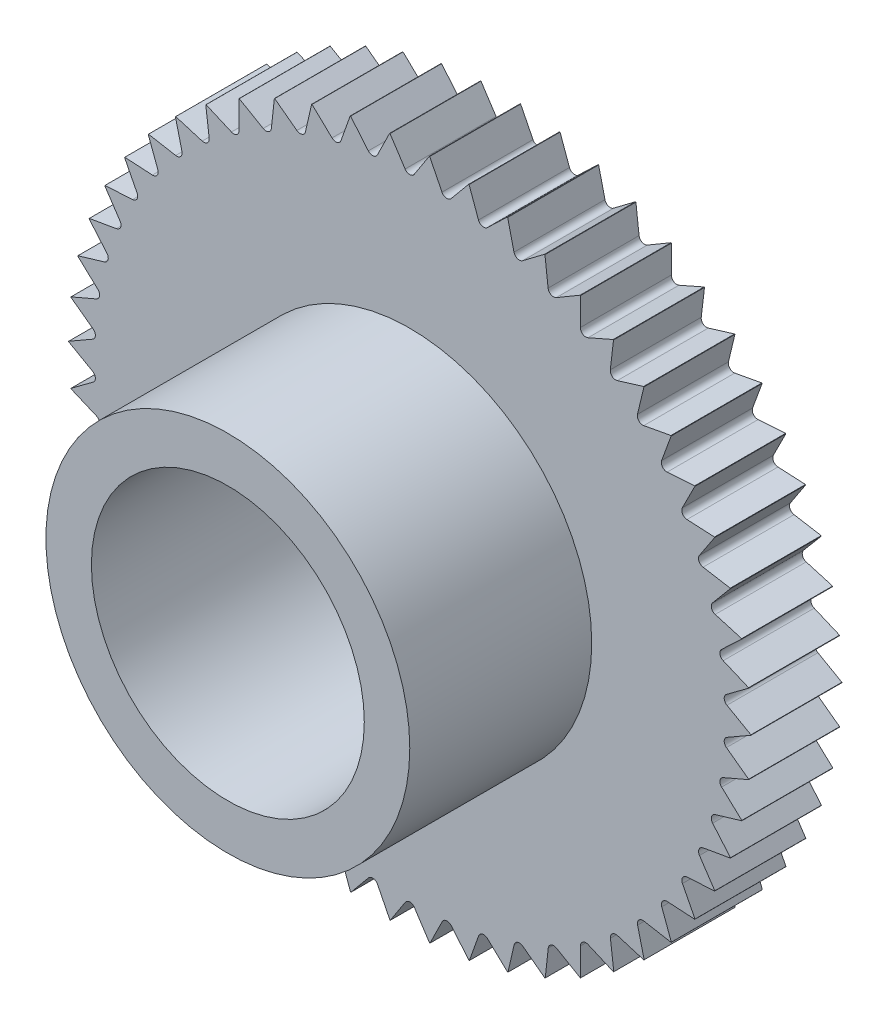
from build123d import *

# Parameters (mm, degrees)
SKETCH1_R           = 7.5
SKETCH1_R_2         = 3
BOSS_EXTRUDE1_DEPTH = 2
SKETCH2_R           = 4
SKETCH2_R_2         = 3
BOSS_EXTRUDE2_DEPTH = 4
CUT_EXTRUDE1_DEPTH  = 4
CIRPATTERN2_DEPTH   = 2


# Read off the part's stored shape, not the designer's step: CirPattern2
with BuildPart() as part:
    # Sketch1 → Boss-Extrude1 (new body)
    with BuildSketch(Plane.XY):
        Circle(SKETCH1_R)
        Circle(SKETCH1_R_2, mode=Mode.SUBTRACT)
    extrude(amount=BOSS_EXTRUDE1_DEPTH)

    # Sketch2 → Boss-Extrude2 (add)
    with BuildSketch(Plane.XY.offset(2)):
        Circle(SKETCH2_R)
        Circle(SKETCH2_R_2, mode=Mode.SUBTRACT)
    extrude(amount=BOSS_EXTRUDE2_DEPTH)

    # Sketch3 → Cut-Extrude1 (cut)
    with BuildSketch(Plane.XY.offset(2)):
        with BuildLine():
            Line((-0.102196566, 6.979193161), (-0.456130011, 7.519067318))
            ThreePointArc((-0.456130011, 7.519067318), (-0.003192278, 7.59724989), (0.450180792, 7.521632669))
            Line((0.450180792, 7.521632669), (0.098937855, 6.97918994))
            ThreePointArc((0.098937855, 6.97918994), (-0.001630231, 6.924500456), (-0.102196566, 6.979193161))
        make_face()
    extrude(amount=-CUT_EXTRUDE1_DEPTH, mode=Mode.SUBTRACT)

    # CirPattern2 outline → CirPattern2 (cut)
    with BuildSketch(Plane.XY):
        with BuildLine():
            ThreePointArc((0.708729323, 6.943866651), (0.802266229, 6.877868719), (0.908503371, 6.920513171))
            Line((0.908503371, 6.920513171), (1.294630408, 7.387417148))
            ThreePointArc((1.294630408, 7.387417148), (0.867169952, 7.449699073), (0.436832782, 7.487267667))
            Line((0.436832782, 7.487267667), (0.708729323, 6.943866651))
        make_face()
        with BuildLine():
            ThreePointArc((-0.44392216, 7.48685068), (-0.874223564, 7.448874623), (-1.301624855, 7.38618797))
            Line((-1.301624855, 7.38618797), (-0.911740421, 6.920138056))
            ThreePointArc((-0.911740421, 6.920138056), (-0.805504645, 6.877490203), (-0.711965626, 6.943485138))
            Line((-0.711965626, 6.943485138), (-0.44392216, 7.48685068))
        make_face()
        with BuildLine():
            ThreePointArc((-1.31009083, 7.384691057), (-1.733073939, 7.297016836), (-2.150307819, 7.185135786))
            Line((-2.150307819, 7.185135786), (-1.708954552, 6.767499956))
            ThreePointArc((-1.708954552, 6.767499956), (-1.598485991, 6.737473693), (-1.513240993, 6.813881611))
            Line((-1.513240993, 6.813881611), (-1.31009083, 7.384691057))
        make_face()
        with BuildLine():
            ThreePointArc((-2.158542769, 7.182666155), (-2.568487462, 7.046479414), (-2.969911558, 6.886916967))
            Line((-2.969911558, 6.886916967), (-2.483058004, 6.523343028))
            ThreePointArc((-2.483058004, 6.523343028), (-2.369850555, 6.506344409), (-2.294052372, 6.592132025))
            Line((-2.294052372, 6.592132025), (-2.158542769, 7.182666155))
        make_face()
        with BuildLine():
            ThreePointArc((-2.97780412, 6.883508015), (-3.369166598, 6.700650447), (-3.749352338, 6.495564411))
            Line((-3.749352338, 6.495564411), (-3.223582356, 6.190969077))
            ThreePointArc((-3.223582356, 6.190969077), (-3.109166956, 6.187227979), (-3.043840627, 6.281235161))
            Line((-3.043840627, 6.281235161), (-2.97780412, 6.883508015))
        make_face()
        with BuildLine():
            ThreePointArc((-3.756795779, 6.491262238), (-4.124283536, 6.264206676), (-4.478089561, 6.016370488))
            Line((-4.478089561, 6.016370488), (-3.920513287, 5.774872889))
            ThreePointArc((-3.920513287, 5.774872889), (-3.806437208, 5.784439904), (-3.75246616, 5.885395368))
            Line((-3.75246616, 5.885395368), (-3.756795779, 6.491262238))
        make_face()
        with BuildLine():
            ThreePointArc((-4.484983219, 6.011233275), (-4.823626613, 5.743050258), (-5.146268303, 5.455815477))
            Line((-5.146268303, 5.455815477), (-4.564426001, 5.280681452))
            ThreePointArc((-4.564426001, 5.280681452), (-4.452231926, 5.303427203), (-4.410346025, 5.409965698))
            Line((-4.410346025, 5.409965698), (-4.484983219, 6.011233275))
        make_face()
        with BuildLine():
            ThreePointArc((-5.152518955, 5.449912694), (-5.457738416, 5.144228936), (-5.744852595, 4.82147992))
            Line((-5.744852595, 4.82147992), (-5.146612683, 4.715077858))
            ThreePointArc((-5.146612683, 4.715077858), (-5.037817845, 4.750694747), (-5.008583527, 4.861375523))
            Line((-5.008583527, 4.861375523), (-5.152518955, 5.449912694))
        make_face()
        with BuildLine():
            ThreePointArc((-5.750375711, 4.814891394), (-6.018043669, 4.475840743), (-6.265747611, 4.121942118))
            Line((-6.265747611, 4.121942118), (-5.659200258, 4.085710924))
            ThreePointArc((-5.659200258, 4.085710924), (-5.555275921, 4.133717295), (-5.539088528, 4.247043584))
            Line((-5.539088528, 4.247043584), (-5.750375711, 4.814891394))
        make_face()
        with BuildLine():
            ThreePointArc((-6.270468501, 4.114756947), (-6.496965205, 3.746924482), (-6.701909139, 3.366662121))
            Line((-6.701909139, 3.366662121), (-6.095256858, 3.401091758))
            ThreePointArc((-6.095256858, 3.401091758), (-5.997608419, 3.460838406), (-5.994686859, 3.575277665))
            Line((-5.994686859, 3.575277665), (-6.270468501, 4.114756947))
        make_face()
        with BuildLine():
            ThreePointArc((-6.705763961, 3.358977471), (-6.888026432, 2.967337495), (-7.047438844, 2.565853794))
            Line((-7.047438844, 2.565853794), (-6.448885565, 2.670478662))
            ThreePointArc((-6.448885565, 2.670478662), (-6.358833552, 2.741157616), (-6.369217334, 2.85516225))
            Line((-6.369217334, 2.85516225), (-6.705763961, 3.358977471))
        make_face()
        with BuildLine():
            ThreePointArc((-7.050375466, 2.557773588), (-7.185938919, 2.14762236), (-7.297664027, 1.730346696))
            Line((-7.297664027, 1.730346696), (-6.715304158, 1.903751922))
            ThreePointArc((-6.715304158, 1.903751922), (-6.63406637, 1.984407371), (-6.65761507, 2.096435664))
            Line((-6.65761507, 2.096435664), (-7.050375466, 2.557773588))
        make_face()
        with BuildLine():
            ThreePointArc((-7.299642739, 1.721980204), (-7.386673908, 1.298864316), (-7.449200824, 0.871439628))
            Line((-7.449200824, 0.871439628), (-6.890909782, 1.111280204))
            ThreePointArc((-6.890909782, 1.111280204), (-6.819584821, 1.200821421), (-6.855979985, 1.309358381))
            Line((-6.855979985, 1.309358381), (-7.299642739, 1.721980204))
        make_face()
        with BuildLine():
            ThreePointArc((-7.450194866, 0.862899992), (-7.487516805, 0.43254136), (-7.499999959, 0.000747833))
            Line((-7.499999959, 0.000747833), (-6.973327673, 0.303780327))
            ThreePointArc((-6.973327673, 0.303780327), (-6.912880087, 0.400996421), (-6.961629531, 0.504574272))
            Line((-6.961629531, 0.504574272), (-7.450194866, 0.862899992))
        make_face()
        with BuildLine():
            ThreePointArc((-7.499995888, -0.007849462), (-7.487103882, -0.439630976), (-7.44937446, -0.869954076))
            Line((-7.44937446, -0.869954076), (-6.961443269, -0.507827658))
            ThreePointArc((-6.961443269, -0.507827658), (-6.912690508, -0.404251368), (-6.97313498, -0.307033338))
            Line((-6.97313498, -0.307033338), (-7.499995888, -0.007849462))
        make_face()
        with BuildLine():
            ThreePointArc((-7.448372332, -0.878492766), (-7.385440723, -1.305858056), (-7.298008951, -1.728891346))
            Line((-7.298008951, -1.728891346), (-6.855417287, -1.312568144))
            ThreePointArc((-6.855417287, -1.312568144), (-6.819018648, -1.20403235), (-6.890340741, -1.114488848))
            Line((-6.890340741, -1.114488848), (-7.448372332, -0.878492766))
        make_face()
        with BuildLine():
            ThreePointArc((-7.296022318, -1.737255961), (-7.183902148, -2.154425647), (-7.047950391, -2.564448328))
            Line((-7.047950391, -2.564448328), (-6.656683547, -2.099558398))
            ThreePointArc((-6.656683547, -2.099558398), (-6.633131259, -1.98753086), (-6.714366464, -1.906872809))
            Line((-6.714366464, -1.906872809), (-7.296022318, -1.737255961))
        make_face()
        with BuildLine():
            ThreePointArc((-7.045006118, -2.572525751), (-6.88521362, -2.973858327), (-6.702580393, -3.365325545))
            Line((-6.702580393, -3.365325545), (-6.367929582, -2.858155727))
            ThreePointArc((-6.367929582, -2.858155727), (-6.357542149, -2.744151425), (-6.447591898, -2.673469587))
            Line((-6.447591898, -2.673469587), (-7.045006118, -2.572525751))
        make_face()
        with BuildLine():
            ThreePointArc((-6.698718297, -3.373006541), (-6.49341439, -3.753074674), (-6.266569492, -4.120692508))
            Line((-6.266569492, -4.120692508), (-5.993060292, -3.578101403))
            ThreePointArc((-5.993060292, -3.578101403), (-5.995978188, -3.46366205), (-6.093624713, -3.403912275))
            Line((-6.093624713, -3.403912275), (-6.698718297, -3.373006541))
        make_face()
        with BuildLine():
            ThreePointArc((-6.261841801, -4.127873206), (-6.013802869, -4.481537125), (-5.74581399, -4.820334174))
            Line((-5.74581399, -4.820334174), (-5.537145144, -4.249659395))
            ThreePointArc((-5.537145144, -4.249659395), (-5.553328907, -4.136332587), (-5.657251707, -4.088322888))
            Line((-5.657251707, -4.088322888), (-6.261841801, -4.127873206))
        make_face()
        with BuildLine():
            ThreePointArc((-5.740284638, -4.826917467), (-5.452864981, -5.149394475), (-5.14735621, -5.454789089))
            Line((-5.14735621, -5.454789089), (-5.006349606, -4.863748034))
            ThreePointArc((-5.006349606, -4.863748034), (-5.03558038, -4.753066322), (-5.144374077, -4.717445948))
            Line((-5.144374077, -4.717445948), (-5.740284638, -4.826917467))
        make_face()
        with BuildLine():
            ThreePointArc((-5.141099971, -5.46068595), (-4.818186448, -5.747615098), (-4.479289268, -6.015477339))
            Line((-4.479289268, -6.015477339), (-4.407851778, -5.412062825))
            ThreePointArc((-4.407851778, -5.412062825), (-4.449734267, -5.305522988), (-4.561927613, -5.282773644))
            Line((-4.561927613, -5.282773644), (-5.141099971, -5.46068595))
        make_face()
        with BuildLine():
            ThreePointArc((-4.472390748, -6.020608022), (-4.118350209, -6.268109086), (-3.750647622, -6.494816578))
            Line((-3.750647622, -6.494816578), (-3.749745317, -5.88718875))
            ThreePointArc((-3.749745317, -5.88718875), (-3.803713131, -5.786231558), (-3.917788903, -5.776660889))
            Line((-3.917788903, -5.776660889), (-4.472390748, -6.020608022))
        make_face()
        with BuildLine():
            ThreePointArc((-3.743200112, -6.4991117), (-3.362820349, -6.703837652), (-2.971284901, -6.886324564))
            Line((-2.971284901, -6.886324564), (-3.040929982, -6.282700547))
            ThreePointArc((-3.040929982, -6.282700547), (-3.1062533, -6.188691272), (-3.22066882, -6.192428705))
            Line((-3.22066882, -6.192428705), (-3.743200112, -6.4991117))
        make_face()
        with BuildLine():
            ThreePointArc((-2.963389115, -6.889726041), (-2.561814112, -7.048908315), (-2.15174065, -7.184706825))
            Line((-2.15174065, -7.184706825), (-2.290991287, -6.593249596))
            ThreePointArc((-2.290991287, -6.593249596), (-2.366786722, -6.507459553), (-2.479994715, -6.524454546))
            Line((-2.479994715, -6.524454546), (-2.963389115, -6.889726041))
        make_face()
        with BuildLine():
            ThreePointArc((-2.143503365, -7.187168657), (-1.726163734, -7.298654585), (-1.303097797, -7.38592825))
            Line((-1.303097797, -7.38592825), (-1.510070864, -6.814636256))
            ThreePointArc((-1.510070864, -6.814636256), (-1.595313414, -6.738225607), (-1.705782937, -6.768248332))
            Line((-1.705782937, -6.768248332), (-2.143503365, -7.187168657))
        make_face()
        with BuildLine():
            ThreePointArc((-1.294630408, -7.387417146), (-0.867169952, -7.449699072), (-0.436832782, -7.487267667))
            Line((-0.436832782, -7.487267667), (-0.708729323, -6.943866651))
            ThreePointArc((-0.708729323, -6.943866651), (-0.802266229, -6.877868719), (-0.908503371, -6.920513171))
            Line((-0.908503371, -6.920513171), (-1.294630408, -7.387417146))
        make_face()
        with BuildLine():
            ThreePointArc((-0.428249796, -7.487763491), (0.003550815, -7.499999159), (0.435339647, -7.487354632))
            Line((0.435339647, -7.487354632), (0.102196566, -6.979193161))
            ThreePointArc((0.102196566, -6.979193161), (0.001630231, -6.924500456), (-0.098937855, -6.97918994))
            Line((-0.098937855, -6.97918994), (-0.428249796, -7.487763491))
        make_face()
        with BuildLine():
            ThreePointArc((0.44392216, -7.486850681), (0.874223564, -7.448874624), (1.301624855, -7.386187971))
            Line((1.301624855, -7.386187971), (0.911740421, -6.920138056))
            ThreePointArc((0.911740421, -6.920138056), (0.805504645, -6.877490203), (0.711965626, -6.943485138))
            Line((0.711965626, -6.943485138), (0.44392216, -7.486850681))
        make_face()
        with BuildLine():
            ThreePointArc((1.31009083, -7.384691058), (1.733073939, -7.297016837), (2.150307819, -7.185135788))
            Line((2.150307819, -7.185135788), (1.708954552, -6.767499956))
            ThreePointArc((1.708954552, -6.767499956), (1.598485991, -6.737473693), (1.513240993, -6.813881611))
            Line((1.513240993, -6.813881611), (1.31009083, -7.384691058))
        make_face()
        with BuildLine():
            ThreePointArc((2.158542769, -7.182666157), (2.568487463, -7.046479416), (2.969911559, -6.88691697))
            Line((2.969911559, -6.88691697), (2.483058004, -6.523343028))
            ThreePointArc((2.483058004, -6.523343028), (2.369850555, -6.506344409), (2.294052372, -6.592132025))
            Line((2.294052372, -6.592132025), (2.158542769, -7.182666157))
        make_face()
        with BuildLine():
            ThreePointArc((2.977804121, -6.883508018), (3.369166599, -6.700650449), (3.74935234, -6.495564414))
            Line((3.74935234, -6.495564414), (3.223582356, -6.190969077))
            ThreePointArc((3.223582356, -6.190969077), (3.109166956, -6.187227979), (3.043840627, -6.281235161))
            Line((3.043840627, -6.281235161), (2.977804121, -6.883508018))
        make_face()
        with BuildLine():
            ThreePointArc((3.756795781, -6.491262241), (4.124283538, -6.26420668), (4.478089563, -6.016370492))
            Line((4.478089563, -6.016370492), (3.920513287, -5.774872889))
            ThreePointArc((3.920513287, -5.774872889), (3.806437208, -5.784439904), (3.75246616, -5.885395368))
            Line((3.75246616, -5.885395368), (3.756795781, -6.491262241))
        make_face()
        with BuildLine():
            ThreePointArc((4.484983221, -6.011233279), (4.823626616, -5.743050261), (5.146268306, -5.45581548))
            Line((5.146268306, -5.45581548), (4.564426001, -5.280681452))
            ThreePointArc((4.564426001, -5.280681452), (4.452231926, -5.303427203), (4.410346025, -5.409965698))
            Line((4.410346025, -5.409965698), (4.484983221, -6.011233279))
        make_face()
        with BuildLine():
            ThreePointArc((5.152518959, -5.449912698), (5.457738419, -5.144228939), (5.744852599, -4.821479924))
            Line((5.744852599, -4.821479924), (5.146612683, -4.715077858))
            ThreePointArc((5.146612683, -4.715077858), (5.037817845, -4.750694747), (5.008583527, -4.861375523))
            Line((5.008583527, -4.861375523), (5.152518959, -5.449912698))
        make_face()
        with BuildLine():
            ThreePointArc((5.750375715, -4.814891397), (6.018043673, -4.475840746), (6.265747616, -4.121942121))
            Line((6.265747616, -4.121942121), (5.659200258, -4.085710924))
            ThreePointArc((5.659200258, -4.085710924), (5.555275921, -4.133717295), (5.539088528, -4.247043584))
            Line((5.539088528, -4.247043584), (5.750375715, -4.814891397))
        make_face()
        with BuildLine():
            ThreePointArc((6.270468506, -4.11475695), (6.49696521, -3.746924485), (6.701909145, -3.366662124))
            Line((6.701909145, -3.366662124), (6.095256858, -3.401091758))
            ThreePointArc((6.095256858, -3.401091758), (5.997608419, -3.460838406), (5.994686859, -3.575277665))
            Line((5.994686859, -3.575277665), (6.270468506, -4.11475695))
        make_face()
        with BuildLine():
            ThreePointArc((6.705763966, -3.358977474), (6.888026439, -2.967337498), (7.04743885, -2.565853796))
            Line((7.04743885, -2.565853796), (6.448885565, -2.670478662))
            ThreePointArc((6.448885565, -2.670478662), (6.358833552, -2.741157616), (6.369217334, -2.85516225))
            Line((6.369217334, -2.85516225), (6.705763966, -3.358977474))
        make_face()
        with BuildLine():
            ThreePointArc((7.050375473, -2.55777359), (7.185938925, -2.147622362), (7.297664034, -1.730346698))
            Line((7.297664034, -1.730346698), (6.715304158, -1.903751922))
            ThreePointArc((6.715304158, -1.903751922), (6.63406637, -1.984407371), (6.65761507, -2.096435664))
            Line((6.65761507, -2.096435664), (7.050375473, -2.55777359))
        make_face()
        with BuildLine():
            ThreePointArc((7.299642746, -1.721980206), (7.386673916, -1.298864317), (7.449200831, -0.871439628))
            Line((7.449200831, -0.871439628), (6.890909782, -1.111280204))
            ThreePointArc((6.890909782, -1.111280204), (6.819584821, -1.200821421), (6.855979985, -1.309358381))
            Line((6.855979985, -1.309358381), (7.299642746, -1.721980206))
        make_face()
        with BuildLine():
            ThreePointArc((7.450194873, -0.862899992), (7.487516813, -0.43254136), (7.499999966, -0.000747833))
            Line((7.499999966, -0.000747833), (6.973327673, -0.303780327))
            ThreePointArc((6.973327673, -0.303780327), (6.912880087, -0.400996421), (6.961629531, -0.504574272))
            Line((6.961629531, -0.504574272), (7.450194873, -0.862899992))
        make_face()
        with BuildLine():
            ThreePointArc((7.499995896, 0.007849462), (7.48710389, 0.439630976), (7.449374467, 0.869954076))
            Line((7.449374467, 0.869954076), (6.961443269, 0.507827658))
            ThreePointArc((6.961443269, 0.507827658), (6.912690508, 0.404251368), (6.97313498, 0.307033338))
            Line((6.97313498, 0.307033338), (7.499995896, 0.007849462))
        make_face()
        with BuildLine():
            ThreePointArc((7.44837234, 0.878492766), (7.38544073, 1.305858058), (7.298008958, 1.728891348))
            Line((7.298008958, 1.728891348), (6.855417287, 1.312568144))
            ThreePointArc((6.855417287, 1.312568144), (6.819018648, 1.20403235), (6.890340741, 1.114488848))
            Line((6.890340741, 1.114488848), (7.44837234, 0.878492766))
        make_face()
        with BuildLine():
            ThreePointArc((7.296022325, 1.737255963), (7.183902155, 2.154425649), (7.047950398, 2.56444833))
            Line((7.047950398, 2.56444833), (6.656683547, 2.099558398))
            ThreePointArc((6.656683547, 2.099558398), (6.633131259, 1.98753086), (6.714366464, 1.906872809))
            Line((6.714366464, 1.906872809), (7.296022325, 1.737255963))
        make_face()
        with BuildLine():
            ThreePointArc((7.045006125, 2.572525753), (6.885213627, 2.973858329), (6.702580399, 3.365325548))
            Line((6.702580399, 3.365325548), (6.367929582, 2.858155727))
            ThreePointArc((6.367929582, 2.858155727), (6.357542149, 2.744151425), (6.447591898, 2.673469587))
            Line((6.447591898, 2.673469587), (7.045006125, 2.572525753))
        make_face()
        with BuildLine():
            ThreePointArc((6.698718303, 3.373006544), (6.493414395, 3.753074677), (6.266569497, 4.120692512))
            Line((6.266569497, 4.120692512), (5.993060292, 3.578101403))
            ThreePointArc((5.993060292, 3.578101403), (5.995978188, 3.46366205), (6.093624713, 3.403912275))
            Line((6.093624713, 3.403912275), (6.698718303, 3.373006544))
        make_face()
        with BuildLine():
            ThreePointArc((6.261841806, 4.12787321), (6.013802874, 4.481537129), (5.745813994, 4.820334178))
            Line((5.745813994, 4.820334178), (5.537145144, 4.249659395))
            ThreePointArc((5.537145144, 4.249659395), (5.553328907, 4.136332587), (5.657251707, 4.088322888))
            Line((5.657251707, 4.088322888), (6.261841806, 4.12787321))
        make_face()
        with BuildLine():
            ThreePointArc((5.740284642, 4.826917471), (5.452864985, 5.149394478), (5.147356214, 5.454789093))
            Line((5.147356214, 5.454789093), (5.006349606, 4.863748034))
            ThreePointArc((5.006349606, 4.863748034), (5.03558038, 4.753066322), (5.144374077, 4.717445948))
            Line((5.144374077, 4.717445948), (5.740284642, 4.826917471))
        make_face()
        with BuildLine():
            ThreePointArc((5.141099975, 5.460685954), (4.818186451, 5.747615101), (4.47928927, 6.015477343))
            Line((4.47928927, 6.015477343), (4.407851778, 5.412062825))
            ThreePointArc((4.407851778, 5.412062825), (4.449734267, 5.305522988), (4.561927613, 5.282773644))
            Line((4.561927613, 5.282773644), (5.141099975, 5.460685954))
        make_face()
        with BuildLine():
            ThreePointArc((4.472390751, 6.020608026), (4.118350212, 6.26810909), (3.750647624, 6.494816581))
            Line((3.750647624, 6.494816581), (3.749745317, 5.88718875))
            ThreePointArc((3.749745317, 5.88718875), (3.803713131, 5.786231558), (3.917788903, 5.776660889))
            Line((3.917788903, 5.776660889), (4.472390751, 6.020608026))
        make_face()
        with BuildLine():
            ThreePointArc((3.743200114, 6.499111703), (3.36282035, 6.703837656), (2.971284903, 6.886324567))
            Line((2.971284903, 6.886324567), (3.040929982, 6.282700547))
            ThreePointArc((3.040929982, 6.282700547), (3.1062533, 6.188691272), (3.22066882, 6.192428705))
            Line((3.22066882, 6.192428705), (3.743200114, 6.499111703))
        make_face()
        with BuildLine():
            ThreePointArc((2.963389116, 6.889726044), (2.561814113, 7.048908317), (2.15174065, 7.184706827))
            Line((2.15174065, 7.184706827), (2.290991287, 6.593249596))
            ThreePointArc((2.290991287, 6.593249596), (2.366786722, 6.507459553), (2.479994715, 6.524454546))
            Line((2.479994715, 6.524454546), (2.963389116, 6.889726044))
        make_face()
        with BuildLine():
            ThreePointArc((2.143503365, 7.187168659), (1.726163734, 7.298654586), (1.303097797, 7.385928252))
            Line((1.303097797, 7.385928252), (1.510070864, 6.814636256))
            ThreePointArc((1.510070864, 6.814636256), (1.595313414, 6.738225607), (1.705782937, 6.768248332))
            Line((1.705782937, 6.768248332), (2.143503365, 7.187168659))
        make_face()
    extrude(amount=CIRPATTERN2_DEPTH, mode=Mode.SUBTRACT)


solid = part.part
